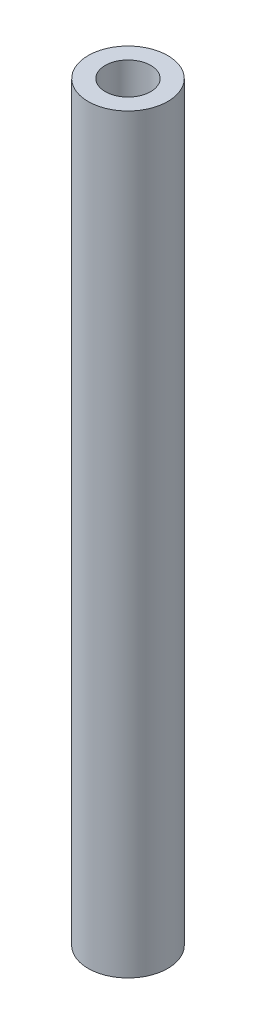
from build123d import *

# Parameters (mm, degrees)
ESBO_O1_W = 1.5
ESBO_O1_H = 66


with BuildPart() as part:
    # Esboço1 → Revolução1 (revolve)
    with BuildSketch(Plane(origin=(0, 0, 0), x_dir=(-1, 0, 0), z_dir=(0, 0, -1))):
        with Locations((53.96460554, -33)):
            Rectangle(ESBO_O1_W, ESBO_O1_H)
    revolve(axis=Axis((-56.71460554, -66, 0), (0, 1, 0)))


solid = part.part
